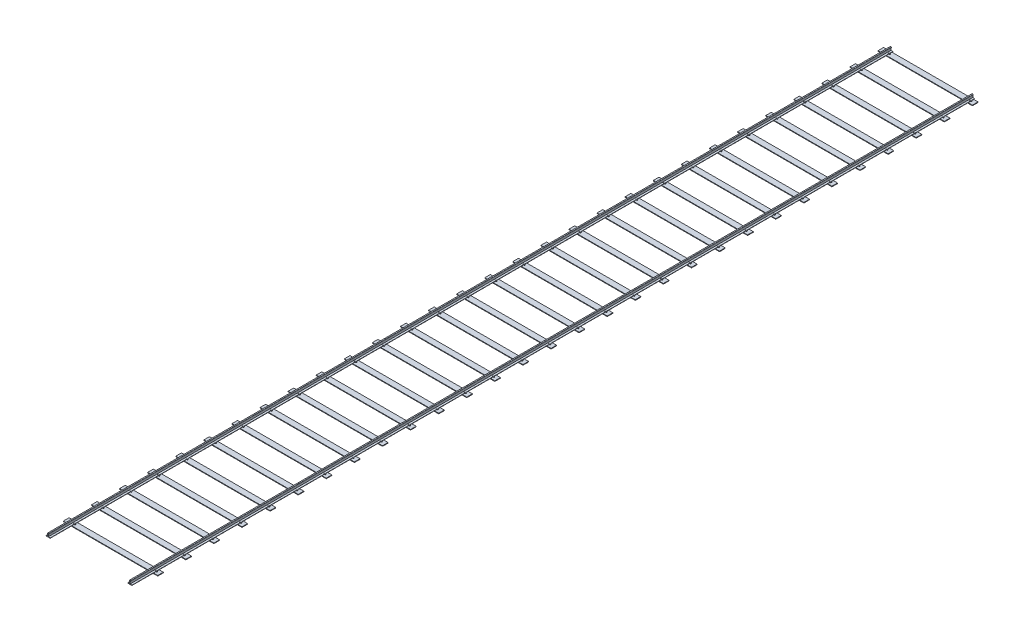
from build123d import *

# Parameters (mm, degrees)
BOSS_EXTRUDE1_START        = -43
SKETCH4_W                  = 1679
SKETCH4_H                  = 100
BOSS_EXTRUDE1_DEPTH        = 10
SKETCH6_W                  = 30
SKETCH6_H                  = 15
BOSS_EXTRUDE2_DEPTH        = 10
LPATTERN1_COUNT            = 6
LPATTERN1_PITCH            = 500
LPATTERN2_COUNT            = 5
LPATTERN2_PITCH            = 3000
LPATTERN2_START            = -43
LPATTERN2_COPY_1_SKETCH_W  = 1679
LPATTERN2_COPY_1_SKETCH_H  = 100
LPATTERN2_COPY_1_DEPTH     = 10
LPATTERN2_COPY_2_SKETCH_W  = 1679
LPATTERN2_COPY_2_SKETCH_H  = 100
LPATTERN2_COPY_2_DEPTH     = 10
LPATTERN2_COPY_3_SKETCH_W  = 1679
LPATTERN2_COPY_3_SKETCH_H  = 100
LPATTERN2_COPY_3_DEPTH     = 10
LPATTERN2_COPY_4_SKETCH_W  = 1679
LPATTERN2_COPY_4_SKETCH_H  = 100
LPATTERN2_COPY_4_DEPTH     = 10
LPATTERN2_COPY_5_SKETCH_W  = 1679
LPATTERN2_COPY_5_SKETCH_H  = 100
LPATTERN2_COPY_5_DEPTH     = 10
LPATTERN2_COPY_6_SKETCH_W  = 1679
LPATTERN2_COPY_6_SKETCH_H  = 100
LPATTERN2_COPY_6_DEPTH     = 10
LPATTERN2_COPY_7_SKETCH_W  = 1679
LPATTERN2_COPY_7_SKETCH_H  = 100
LPATTERN2_COPY_7_DEPTH     = 10
LPATTERN2_COPY_8_SKETCH_W  = 1679
LPATTERN2_COPY_8_SKETCH_H  = 100
LPATTERN2_COPY_8_DEPTH     = 10
LPATTERN2_COPY_9_SKETCH_W  = 1679
LPATTERN2_COPY_9_SKETCH_H  = 100
LPATTERN2_COPY_9_DEPTH     = 10
LPATTERN2_COPY_10_SKETCH_W = 1679
LPATTERN2_COPY_10_SKETCH_H = 100
LPATTERN2_COPY_10_DEPTH    = 10
LPATTERN2_COPY_11_SKETCH_W = 1679
LPATTERN2_COPY_11_SKETCH_H = 100
LPATTERN2_COPY_11_DEPTH    = 10
LPATTERN2_COPY_12_SKETCH_W = 1679
LPATTERN2_COPY_12_SKETCH_H = 100
LPATTERN2_COPY_12_DEPTH    = 10
LPATTERN2_COPY_13_SKETCH_W = 1679
LPATTERN2_COPY_13_SKETCH_H = 100
LPATTERN2_COPY_13_DEPTH    = 10
LPATTERN2_COPY_14_SKETCH_W = 1679
LPATTERN2_COPY_14_SKETCH_H = 100
LPATTERN2_COPY_14_DEPTH    = 10
LPATTERN2_COPY_15_SKETCH_W = 1679
LPATTERN2_COPY_15_SKETCH_H = 100
LPATTERN2_COPY_15_DEPTH    = 10
LPATTERN2_COPY_16_SKETCH_W = 1679
LPATTERN2_COPY_16_SKETCH_H = 100
LPATTERN2_COPY_16_DEPTH    = 10
LPATTERN2_COPY_17_SKETCH_W = 1679
LPATTERN2_COPY_17_SKETCH_H = 100
LPATTERN2_COPY_17_DEPTH    = 10
LPATTERN2_COPY_18_SKETCH_W = 1679
LPATTERN2_COPY_18_SKETCH_H = 100
LPATTERN2_COPY_18_DEPTH    = 10
LPATTERN2_COPY_19_SKETCH_W = 1679
LPATTERN2_COPY_19_SKETCH_H = 100
LPATTERN2_COPY_19_DEPTH    = 10
LPATTERN2_COPY_20_SKETCH_W = 1679
LPATTERN2_COPY_20_SKETCH_H = 100
LPATTERN2_COPY_20_DEPTH    = 10
LPATTERN2_COPY_21_SKETCH_W = 30
LPATTERN2_COPY_21_SKETCH_H = 15
LPATTERN2_COPY_21_DEPTH    = 10
LPATTERN2_COPY_22_SKETCH_W = 30
LPATTERN2_COPY_22_SKETCH_H = 15
LPATTERN2_COPY_22_DEPTH    = 10
LPATTERN2_COPY_23_SKETCH_W = 30
LPATTERN2_COPY_23_SKETCH_H = 15
LPATTERN2_COPY_23_DEPTH    = 10
LPATTERN2_COPY_24_SKETCH_W = 30
LPATTERN2_COPY_24_SKETCH_H = 15
LPATTERN2_COPY_24_DEPTH    = 10
LPATTERN2_COPY_25_SKETCH_W = 30
LPATTERN2_COPY_25_SKETCH_H = 15
LPATTERN2_COPY_25_DEPTH    = 10
LPATTERN2_COPY_26_SKETCH_W = 30
LPATTERN2_COPY_26_SKETCH_H = 15
LPATTERN2_COPY_26_DEPTH    = 10
LPATTERN2_COPY_27_SKETCH_W = 30
LPATTERN2_COPY_27_SKETCH_H = 15
LPATTERN2_COPY_27_DEPTH    = 10
LPATTERN2_COPY_28_SKETCH_W = 30
LPATTERN2_COPY_28_SKETCH_H = 15
LPATTERN2_COPY_28_DEPTH    = 10
LPATTERN2_COPY_29_SKETCH_W = 30
LPATTERN2_COPY_29_SKETCH_H = 15
LPATTERN2_COPY_29_DEPTH    = 10
LPATTERN2_COPY_30_SKETCH_W = 30
LPATTERN2_COPY_30_SKETCH_H = 15
LPATTERN2_COPY_30_DEPTH    = 10
LPATTERN2_COPY_31_SKETCH_W = 30
LPATTERN2_COPY_31_SKETCH_H = 15
LPATTERN2_COPY_31_DEPTH    = 10
LPATTERN2_COPY_32_SKETCH_W = 30
LPATTERN2_COPY_32_SKETCH_H = 15
LPATTERN2_COPY_32_DEPTH    = 10
LPATTERN2_COPY_33_SKETCH_W = 30
LPATTERN2_COPY_33_SKETCH_H = 15
LPATTERN2_COPY_33_DEPTH    = 10
LPATTERN2_COPY_34_SKETCH_W = 30
LPATTERN2_COPY_34_SKETCH_H = 15
LPATTERN2_COPY_34_DEPTH    = 10
LPATTERN2_COPY_35_SKETCH_W = 30
LPATTERN2_COPY_35_SKETCH_H = 15
LPATTERN2_COPY_35_DEPTH    = 10
LPATTERN2_COPY_36_SKETCH_W = 30
LPATTERN2_COPY_36_SKETCH_H = 15
LPATTERN2_COPY_36_DEPTH    = 10
LPATTERN2_COPY_37_SKETCH_W = 30
LPATTERN2_COPY_37_SKETCH_H = 15
LPATTERN2_COPY_37_DEPTH    = 10
LPATTERN2_COPY_38_SKETCH_W = 30
LPATTERN2_COPY_38_SKETCH_H = 15
LPATTERN2_COPY_38_DEPTH    = 10
LPATTERN2_COPY_39_SKETCH_W = 30
LPATTERN2_COPY_39_SKETCH_H = 15
LPATTERN2_COPY_39_DEPTH    = 10
LPATTERN2_COPY_40_SKETCH_W = 30
LPATTERN2_COPY_40_SKETCH_H = 15
LPATTERN2_COPY_40_DEPTH    = 10


with BuildPart() as part:
    # Sweep2: sweep along a path in Sketch3
    with BuildLine(Plane(origin=(0, 0, 0), x_dir=(1, 0, 0), z_dir=(0, 1, 0))) as sweep2_path:
        Line((0, 0), (0, -3000))
    # Sketch2 → Sweep2 (sweep)
    with BuildSketch(Plane.XY):
        with BuildLine():
            Line((-717.5, 0), (-717.5, 14))
            add(Edge.make_bspline(
                [(-717.5, 14), (-717.5, 17), (-727.5, 17), (-737.5, 17), (-737.5, 14)],
                knots=[3.141592654, 3.141592654, 3.141592654, 4.71238898, 4.71238898, 6.283185307, 6.283185307, 6.283185307], degree=2, weights=[1, 0.707106781, 1, 0.707106781, 1]))
            Line((-737.5, 14), (-737.5, 0))
            Line((-737.5, 0), (-734.5, -3))
            Line((-734.5, -3), (-734.5, -33))
            Line((-734.5, -33), (-764.5, -38))
            Line((-764.5, -38), (-764.5, -43))
            Line((-764.5, -43), (-690.5, -43))
            Line((-690.5, -43), (-690.5, -38))
            Line((-690.5, -38), (-720.5, -33))
            Line((-720.5, -33), (-720.5, -3))
            Line((-720.5, -3), (-717.5, 0))
        make_face()
        with BuildLine():
            Line((764.5, -43), (764.5, -38))
            Line((764.5, -38), (734.5, -33))
            Line((734.5, -33), (734.5, -3))
            Line((734.5, -3), (737.5, 0))
            Line((737.5, 0), (737.5, 14))
            add(Edge.make_bspline(
                [(737.5, 14), (737.5, 17), (727.5, 17), (717.5, 17), (717.5, 14)],
                knots=[0, 0, 0, 1.570796327, 1.570796327, 3.141592654, 3.141592654, 3.141592654], degree=2, weights=[1, 0.707106781, 1, 0.707106781, 1]))
            Line((717.5, 14), (717.5, 0))
            Line((717.5, 0), (720.5, -3))
            Line((720.5, -3), (720.5, -33))
            Line((720.5, -33), (690.5, -38))
            Line((690.5, -38), (690.5, -43))
            Line((690.5, -43), (764.5, -43))
        make_face()
    sweep2 = sweep(path=sweep2_path.line)

    # Sketch4 → Boss-Extrude1 (add)
    with BuildSketch(Plane(origin=(0, 0, 0), x_dir=(1, 0, 0), z_dir=(0, 1, 0)).offset(BOSS_EXTRUDE1_START)):
        with Locations((0, -65)):
            Rectangle(SKETCH4_W, SKETCH4_H)
    boss_extrude1 = extrude(amount=-BOSS_EXTRUDE1_DEPTH)

    # Sketch6 → Boss-Extrude2 (add)
    with BuildSketch(Plane(origin=(0, -43, 0), x_dir=(1, 0, 0), z_dir=(0, 1, 0))):
        with Locations((764.5, -65)):
            Rectangle(SKETCH6_W, SKETCH6_H)
        with Locations((690.5, -65)):
            Rectangle(SKETCH6_W, SKETCH6_H)
        with Locations((-690.5, -65)):
            Rectangle(SKETCH6_W, SKETCH6_H)
        with Locations((-764.5, -65)):
            Rectangle(SKETCH6_W, SKETCH6_H)
    boss_extrude2 = extrude(amount=BOSS_EXTRUDE2_DEPTH)

    # LPattern1: Boss-Extrude1, Boss-Extrude2 ×6
    with Locations(*[(0, 0, i * LPATTERN1_PITCH) for i in range(1, LPATTERN1_COUNT)]):
        add(boss_extrude1)
        add(boss_extrude2)

    # LPattern2: Sweep2, Boss-Extrude1, Boss-Extrude2 ×5
    with Locations(*[(0, 0, -i * LPATTERN2_PITCH) for i in range(1, LPATTERN2_COUNT)]):
        add(sweep2)
        add(boss_extrude1)
        add(boss_extrude2)

    # LPattern2 copy 1 sketch → LPattern2 copy 1 (add)
    with BuildSketch(Plane(origin=(0, 0, -2500), x_dir=(1, 0, 0), z_dir=(0, 1, 0)).offset(LPATTERN2_START)):
        with Locations((0, -65)):
            Rectangle(LPATTERN2_COPY_1_SKETCH_W, LPATTERN2_COPY_1_SKETCH_H)
    extrude(amount=-LPATTERN2_COPY_1_DEPTH)

    # LPattern2 copy 2 sketch → LPattern2 copy 2 (add)
    with BuildSketch(Plane(origin=(0, 0, -5500), x_dir=(1, 0, 0), z_dir=(0, 1, 0)).offset(LPATTERN2_START)):
        with Locations((0, -65)):
            Rectangle(LPATTERN2_COPY_2_SKETCH_W, LPATTERN2_COPY_2_SKETCH_H)
    extrude(amount=-LPATTERN2_COPY_2_DEPTH)

    # LPattern2 copy 3 sketch → LPattern2 copy 3 (add)
    with BuildSketch(Plane(origin=(0, 0, -8500), x_dir=(1, 0, 0), z_dir=(0, 1, 0)).offset(LPATTERN2_START)):
        with Locations((0, -65)):
            Rectangle(LPATTERN2_COPY_3_SKETCH_W, LPATTERN2_COPY_3_SKETCH_H)
    extrude(amount=-LPATTERN2_COPY_3_DEPTH)

    # LPattern2 copy 4 sketch → LPattern2 copy 4 (add)
    with BuildSketch(Plane(origin=(0, 0, -11500), x_dir=(1, 0, 0), z_dir=(0, 1, 0)).offset(LPATTERN2_START)):
        with Locations((0, -65)):
            Rectangle(LPATTERN2_COPY_4_SKETCH_W, LPATTERN2_COPY_4_SKETCH_H)
    extrude(amount=-LPATTERN2_COPY_4_DEPTH)

    # LPattern2 copy 5 sketch → LPattern2 copy 5 (add)
    with BuildSketch(Plane(origin=(0, 0, -2000), x_dir=(1, 0, 0), z_dir=(0, 1, 0)).offset(LPATTERN2_START)):
        with Locations((0, -65)):
            Rectangle(LPATTERN2_COPY_5_SKETCH_W, LPATTERN2_COPY_5_SKETCH_H)
    extrude(amount=-LPATTERN2_COPY_5_DEPTH)

    # LPattern2 copy 6 sketch → LPattern2 copy 6 (add)
    with BuildSketch(Plane(origin=(0, 0, -5000), x_dir=(1, 0, 0), z_dir=(0, 1, 0)).offset(LPATTERN2_START)):
        with Locations((0, -65)):
            Rectangle(LPATTERN2_COPY_6_SKETCH_W, LPATTERN2_COPY_6_SKETCH_H)
    extrude(amount=-LPATTERN2_COPY_6_DEPTH)

    # LPattern2 copy 7 sketch → LPattern2 copy 7 (add)
    with BuildSketch(Plane(origin=(0, 0, -8000), x_dir=(1, 0, 0), z_dir=(0, 1, 0)).offset(LPATTERN2_START)):
        with Locations((0, -65)):
            Rectangle(LPATTERN2_COPY_7_SKETCH_W, LPATTERN2_COPY_7_SKETCH_H)
    extrude(amount=-LPATTERN2_COPY_7_DEPTH)

    # LPattern2 copy 8 sketch → LPattern2 copy 8 (add)
    with BuildSketch(Plane(origin=(0, 0, -11000), x_dir=(1, 0, 0), z_dir=(0, 1, 0)).offset(LPATTERN2_START)):
        with Locations((0, -65)):
            Rectangle(LPATTERN2_COPY_8_SKETCH_W, LPATTERN2_COPY_8_SKETCH_H)
    extrude(amount=-LPATTERN2_COPY_8_DEPTH)

    # LPattern2 copy 9 sketch → LPattern2 copy 9 (add)
    with BuildSketch(Plane(origin=(0, 0, -1500), x_dir=(1, 0, 0), z_dir=(0, 1, 0)).offset(LPATTERN2_START)):
        with Locations((0, -65)):
            Rectangle(LPATTERN2_COPY_9_SKETCH_W, LPATTERN2_COPY_9_SKETCH_H)
    extrude(amount=-LPATTERN2_COPY_9_DEPTH)

    # LPattern2 copy 10 sketch → LPattern2 copy 10 (add)
    with BuildSketch(Plane(origin=(0, 0, -4500), x_dir=(1, 0, 0), z_dir=(0, 1, 0)).offset(LPATTERN2_START)):
        with Locations((0, -65)):
            Rectangle(LPATTERN2_COPY_10_SKETCH_W, LPATTERN2_COPY_10_SKETCH_H)
    extrude(amount=-LPATTERN2_COPY_10_DEPTH)

    # LPattern2 copy 11 sketch → LPattern2 copy 11 (add)
    with BuildSketch(Plane(origin=(0, 0, -7500), x_dir=(1, 0, 0), z_dir=(0, 1, 0)).offset(LPATTERN2_START)):
        with Locations((0, -65)):
            Rectangle(LPATTERN2_COPY_11_SKETCH_W, LPATTERN2_COPY_11_SKETCH_H)
    extrude(amount=-LPATTERN2_COPY_11_DEPTH)

    # LPattern2 copy 12 sketch → LPattern2 copy 12 (add)
    with BuildSketch(Plane(origin=(0, 0, -10500), x_dir=(1, 0, 0), z_dir=(0, 1, 0)).offset(LPATTERN2_START)):
        with Locations((0, -65)):
            Rectangle(LPATTERN2_COPY_12_SKETCH_W, LPATTERN2_COPY_12_SKETCH_H)
    extrude(amount=-LPATTERN2_COPY_12_DEPTH)

    # LPattern2 copy 13 sketch → LPattern2 copy 13 (add)
    with BuildSketch(Plane(origin=(0, 0, -1000), x_dir=(1, 0, 0), z_dir=(0, 1, 0)).offset(LPATTERN2_START)):
        with Locations((0, -65)):
            Rectangle(LPATTERN2_COPY_13_SKETCH_W, LPATTERN2_COPY_13_SKETCH_H)
    extrude(amount=-LPATTERN2_COPY_13_DEPTH)

    # LPattern2 copy 14 sketch → LPattern2 copy 14 (add)
    with BuildSketch(Plane(origin=(0, 0, -4000), x_dir=(1, 0, 0), z_dir=(0, 1, 0)).offset(LPATTERN2_START)):
        with Locations((0, -65)):
            Rectangle(LPATTERN2_COPY_14_SKETCH_W, LPATTERN2_COPY_14_SKETCH_H)
    extrude(amount=-LPATTERN2_COPY_14_DEPTH)

    # LPattern2 copy 15 sketch → LPattern2 copy 15 (add)
    with BuildSketch(Plane(origin=(0, 0, -7000), x_dir=(1, 0, 0), z_dir=(0, 1, 0)).offset(LPATTERN2_START)):
        with Locations((0, -65)):
            Rectangle(LPATTERN2_COPY_15_SKETCH_W, LPATTERN2_COPY_15_SKETCH_H)
    extrude(amount=-LPATTERN2_COPY_15_DEPTH)

    # LPattern2 copy 16 sketch → LPattern2 copy 16 (add)
    with BuildSketch(Plane(origin=(0, 0, -10000), x_dir=(1, 0, 0), z_dir=(0, 1, 0)).offset(LPATTERN2_START)):
        with Locations((0, -65)):
            Rectangle(LPATTERN2_COPY_16_SKETCH_W, LPATTERN2_COPY_16_SKETCH_H)
    extrude(amount=-LPATTERN2_COPY_16_DEPTH)

    # LPattern2 copy 17 sketch → LPattern2 copy 17 (add)
    with BuildSketch(Plane(origin=(0, 0, -500), x_dir=(1, 0, 0), z_dir=(0, 1, 0)).offset(LPATTERN2_START)):
        with Locations((0, -65)):
            Rectangle(LPATTERN2_COPY_17_SKETCH_W, LPATTERN2_COPY_17_SKETCH_H)
    extrude(amount=-LPATTERN2_COPY_17_DEPTH)

    # LPattern2 copy 18 sketch → LPattern2 copy 18 (add)
    with BuildSketch(Plane(origin=(0, 0, -3500), x_dir=(1, 0, 0), z_dir=(0, 1, 0)).offset(LPATTERN2_START)):
        with Locations((0, -65)):
            Rectangle(LPATTERN2_COPY_18_SKETCH_W, LPATTERN2_COPY_18_SKETCH_H)
    extrude(amount=-LPATTERN2_COPY_18_DEPTH)

    # LPattern2 copy 19 sketch → LPattern2 copy 19 (add)
    with BuildSketch(Plane(origin=(0, 0, -6500), x_dir=(1, 0, 0), z_dir=(0, 1, 0)).offset(LPATTERN2_START)):
        with Locations((0, -65)):
            Rectangle(LPATTERN2_COPY_19_SKETCH_W, LPATTERN2_COPY_19_SKETCH_H)
    extrude(amount=-LPATTERN2_COPY_19_DEPTH)

    # LPattern2 copy 20 sketch → LPattern2 copy 20 (add)
    with BuildSketch(Plane(origin=(0, 0, -9500), x_dir=(1, 0, 0), z_dir=(0, 1, 0)).offset(LPATTERN2_START)):
        with Locations((0, -65)):
            Rectangle(LPATTERN2_COPY_20_SKETCH_W, LPATTERN2_COPY_20_SKETCH_H)
    extrude(amount=-LPATTERN2_COPY_20_DEPTH)

    # LPattern2 copy 21 sketch → LPattern2 copy 21 (add)
    with BuildSketch(Plane(origin=(0, -43, -2500), x_dir=(1, 0, 0), z_dir=(0, 1, 0))):
        with Locations((764.5, -65)):
            Rectangle(LPATTERN2_COPY_21_SKETCH_W, LPATTERN2_COPY_21_SKETCH_H)
        with Locations((690.5, -65)):
            Rectangle(LPATTERN2_COPY_21_SKETCH_W, LPATTERN2_COPY_21_SKETCH_H)
        with Locations((-690.5, -65)):
            Rectangle(LPATTERN2_COPY_21_SKETCH_W, LPATTERN2_COPY_21_SKETCH_H)
        with Locations((-764.5, -65)):
            Rectangle(LPATTERN2_COPY_21_SKETCH_W, LPATTERN2_COPY_21_SKETCH_H)
    extrude(amount=LPATTERN2_COPY_21_DEPTH)

    # LPattern2 copy 22 sketch → LPattern2 copy 22 (add)
    with BuildSketch(Plane(origin=(0, -43, -5500), x_dir=(1, 0, 0), z_dir=(0, 1, 0))):
        with Locations((764.5, -65)):
            Rectangle(LPATTERN2_COPY_22_SKETCH_W, LPATTERN2_COPY_22_SKETCH_H)
        with Locations((690.5, -65)):
            Rectangle(LPATTERN2_COPY_22_SKETCH_W, LPATTERN2_COPY_22_SKETCH_H)
        with Locations((-690.5, -65)):
            Rectangle(LPATTERN2_COPY_22_SKETCH_W, LPATTERN2_COPY_22_SKETCH_H)
        with Locations((-764.5, -65)):
            Rectangle(LPATTERN2_COPY_22_SKETCH_W, LPATTERN2_COPY_22_SKETCH_H)
    extrude(amount=LPATTERN2_COPY_22_DEPTH)

    # LPattern2 copy 23 sketch → LPattern2 copy 23 (add)
    with BuildSketch(Plane(origin=(0, -43, -8500), x_dir=(1, 0, 0), z_dir=(0, 1, 0))):
        with Locations((764.5, -65)):
            Rectangle(LPATTERN2_COPY_23_SKETCH_W, LPATTERN2_COPY_23_SKETCH_H)
        with Locations((690.5, -65)):
            Rectangle(LPATTERN2_COPY_23_SKETCH_W, LPATTERN2_COPY_23_SKETCH_H)
        with Locations((-690.5, -65)):
            Rectangle(LPATTERN2_COPY_23_SKETCH_W, LPATTERN2_COPY_23_SKETCH_H)
        with Locations((-764.5, -65)):
            Rectangle(LPATTERN2_COPY_23_SKETCH_W, LPATTERN2_COPY_23_SKETCH_H)
    extrude(amount=LPATTERN2_COPY_23_DEPTH)

    # LPattern2 copy 24 sketch → LPattern2 copy 24 (add)
    with BuildSketch(Plane(origin=(0, -43, -11500), x_dir=(1, 0, 0), z_dir=(0, 1, 0))):
        with Locations((764.5, -65)):
            Rectangle(LPATTERN2_COPY_24_SKETCH_W, LPATTERN2_COPY_24_SKETCH_H)
        with Locations((690.5, -65)):
            Rectangle(LPATTERN2_COPY_24_SKETCH_W, LPATTERN2_COPY_24_SKETCH_H)
        with Locations((-690.5, -65)):
            Rectangle(LPATTERN2_COPY_24_SKETCH_W, LPATTERN2_COPY_24_SKETCH_H)
        with Locations((-764.5, -65)):
            Rectangle(LPATTERN2_COPY_24_SKETCH_W, LPATTERN2_COPY_24_SKETCH_H)
    extrude(amount=LPATTERN2_COPY_24_DEPTH)

    # LPattern2 copy 25 sketch → LPattern2 copy 25 (add)
    with BuildSketch(Plane(origin=(0, -43, -2000), x_dir=(1, 0, 0), z_dir=(0, 1, 0))):
        with Locations((764.5, -65)):
            Rectangle(LPATTERN2_COPY_25_SKETCH_W, LPATTERN2_COPY_25_SKETCH_H)
        with Locations((690.5, -65)):
            Rectangle(LPATTERN2_COPY_25_SKETCH_W, LPATTERN2_COPY_25_SKETCH_H)
        with Locations((-690.5, -65)):
            Rectangle(LPATTERN2_COPY_25_SKETCH_W, LPATTERN2_COPY_25_SKETCH_H)
        with Locations((-764.5, -65)):
            Rectangle(LPATTERN2_COPY_25_SKETCH_W, LPATTERN2_COPY_25_SKETCH_H)
    extrude(amount=LPATTERN2_COPY_25_DEPTH)

    # LPattern2 copy 26 sketch → LPattern2 copy 26 (add)
    with BuildSketch(Plane(origin=(0, -43, -5000), x_dir=(1, 0, 0), z_dir=(0, 1, 0))):
        with Locations((764.5, -65)):
            Rectangle(LPATTERN2_COPY_26_SKETCH_W, LPATTERN2_COPY_26_SKETCH_H)
        with Locations((690.5, -65)):
            Rectangle(LPATTERN2_COPY_26_SKETCH_W, LPATTERN2_COPY_26_SKETCH_H)
        with Locations((-690.5, -65)):
            Rectangle(LPATTERN2_COPY_26_SKETCH_W, LPATTERN2_COPY_26_SKETCH_H)
        with Locations((-764.5, -65)):
            Rectangle(LPATTERN2_COPY_26_SKETCH_W, LPATTERN2_COPY_26_SKETCH_H)
    extrude(amount=LPATTERN2_COPY_26_DEPTH)

    # LPattern2 copy 27 sketch → LPattern2 copy 27 (add)
    with BuildSketch(Plane(origin=(0, -43, -8000), x_dir=(1, 0, 0), z_dir=(0, 1, 0))):
        with Locations((764.5, -65)):
            Rectangle(LPATTERN2_COPY_27_SKETCH_W, LPATTERN2_COPY_27_SKETCH_H)
        with Locations((690.5, -65)):
            Rectangle(LPATTERN2_COPY_27_SKETCH_W, LPATTERN2_COPY_27_SKETCH_H)
        with Locations((-690.5, -65)):
            Rectangle(LPATTERN2_COPY_27_SKETCH_W, LPATTERN2_COPY_27_SKETCH_H)
        with Locations((-764.5, -65)):
            Rectangle(LPATTERN2_COPY_27_SKETCH_W, LPATTERN2_COPY_27_SKETCH_H)
    extrude(amount=LPATTERN2_COPY_27_DEPTH)

    # LPattern2 copy 28 sketch → LPattern2 copy 28 (add)
    with BuildSketch(Plane(origin=(0, -43, -11000), x_dir=(1, 0, 0), z_dir=(0, 1, 0))):
        with Locations((764.5, -65)):
            Rectangle(LPATTERN2_COPY_28_SKETCH_W, LPATTERN2_COPY_28_SKETCH_H)
        with Locations((690.5, -65)):
            Rectangle(LPATTERN2_COPY_28_SKETCH_W, LPATTERN2_COPY_28_SKETCH_H)
        with Locations((-690.5, -65)):
            Rectangle(LPATTERN2_COPY_28_SKETCH_W, LPATTERN2_COPY_28_SKETCH_H)
        with Locations((-764.5, -65)):
            Rectangle(LPATTERN2_COPY_28_SKETCH_W, LPATTERN2_COPY_28_SKETCH_H)
    extrude(amount=LPATTERN2_COPY_28_DEPTH)

    # LPattern2 copy 29 sketch → LPattern2 copy 29 (add)
    with BuildSketch(Plane(origin=(0, -43, -1500), x_dir=(1, 0, 0), z_dir=(0, 1, 0))):
        with Locations((764.5, -65)):
            Rectangle(LPATTERN2_COPY_29_SKETCH_W, LPATTERN2_COPY_29_SKETCH_H)
        with Locations((690.5, -65)):
            Rectangle(LPATTERN2_COPY_29_SKETCH_W, LPATTERN2_COPY_29_SKETCH_H)
        with Locations((-690.5, -65)):
            Rectangle(LPATTERN2_COPY_29_SKETCH_W, LPATTERN2_COPY_29_SKETCH_H)
        with Locations((-764.5, -65)):
            Rectangle(LPATTERN2_COPY_29_SKETCH_W, LPATTERN2_COPY_29_SKETCH_H)
    extrude(amount=LPATTERN2_COPY_29_DEPTH)

    # LPattern2 copy 30 sketch → LPattern2 copy 30 (add)
    with BuildSketch(Plane(origin=(0, -43, -4500), x_dir=(1, 0, 0), z_dir=(0, 1, 0))):
        with Locations((764.5, -65)):
            Rectangle(LPATTERN2_COPY_30_SKETCH_W, LPATTERN2_COPY_30_SKETCH_H)
        with Locations((690.5, -65)):
            Rectangle(LPATTERN2_COPY_30_SKETCH_W, LPATTERN2_COPY_30_SKETCH_H)
        with Locations((-690.5, -65)):
            Rectangle(LPATTERN2_COPY_30_SKETCH_W, LPATTERN2_COPY_30_SKETCH_H)
        with Locations((-764.5, -65)):
            Rectangle(LPATTERN2_COPY_30_SKETCH_W, LPATTERN2_COPY_30_SKETCH_H)
    extrude(amount=LPATTERN2_COPY_30_DEPTH)

    # LPattern2 copy 31 sketch → LPattern2 copy 31 (add)
    with BuildSketch(Plane(origin=(0, -43, -7500), x_dir=(1, 0, 0), z_dir=(0, 1, 0))):
        with Locations((764.5, -65)):
            Rectangle(LPATTERN2_COPY_31_SKETCH_W, LPATTERN2_COPY_31_SKETCH_H)
        with Locations((690.5, -65)):
            Rectangle(LPATTERN2_COPY_31_SKETCH_W, LPATTERN2_COPY_31_SKETCH_H)
        with Locations((-690.5, -65)):
            Rectangle(LPATTERN2_COPY_31_SKETCH_W, LPATTERN2_COPY_31_SKETCH_H)
        with Locations((-764.5, -65)):
            Rectangle(LPATTERN2_COPY_31_SKETCH_W, LPATTERN2_COPY_31_SKETCH_H)
    extrude(amount=LPATTERN2_COPY_31_DEPTH)

    # LPattern2 copy 32 sketch → LPattern2 copy 32 (add)
    with BuildSketch(Plane(origin=(0, -43, -10500), x_dir=(1, 0, 0), z_dir=(0, 1, 0))):
        with Locations((764.5, -65)):
            Rectangle(LPATTERN2_COPY_32_SKETCH_W, LPATTERN2_COPY_32_SKETCH_H)
        with Locations((690.5, -65)):
            Rectangle(LPATTERN2_COPY_32_SKETCH_W, LPATTERN2_COPY_32_SKETCH_H)
        with Locations((-690.5, -65)):
            Rectangle(LPATTERN2_COPY_32_SKETCH_W, LPATTERN2_COPY_32_SKETCH_H)
        with Locations((-764.5, -65)):
            Rectangle(LPATTERN2_COPY_32_SKETCH_W, LPATTERN2_COPY_32_SKETCH_H)
    extrude(amount=LPATTERN2_COPY_32_DEPTH)

    # LPattern2 copy 33 sketch → LPattern2 copy 33 (add)
    with BuildSketch(Plane(origin=(0, -43, -1000), x_dir=(1, 0, 0), z_dir=(0, 1, 0))):
        with Locations((764.5, -65)):
            Rectangle(LPATTERN2_COPY_33_SKETCH_W, LPATTERN2_COPY_33_SKETCH_H)
        with Locations((690.5, -65)):
            Rectangle(LPATTERN2_COPY_33_SKETCH_W, LPATTERN2_COPY_33_SKETCH_H)
        with Locations((-690.5, -65)):
            Rectangle(LPATTERN2_COPY_33_SKETCH_W, LPATTERN2_COPY_33_SKETCH_H)
        with Locations((-764.5, -65)):
            Rectangle(LPATTERN2_COPY_33_SKETCH_W, LPATTERN2_COPY_33_SKETCH_H)
    extrude(amount=LPATTERN2_COPY_33_DEPTH)

    # LPattern2 copy 34 sketch → LPattern2 copy 34 (add)
    with BuildSketch(Plane(origin=(0, -43, -4000), x_dir=(1, 0, 0), z_dir=(0, 1, 0))):
        with Locations((764.5, -65)):
            Rectangle(LPATTERN2_COPY_34_SKETCH_W, LPATTERN2_COPY_34_SKETCH_H)
        with Locations((690.5, -65)):
            Rectangle(LPATTERN2_COPY_34_SKETCH_W, LPATTERN2_COPY_34_SKETCH_H)
        with Locations((-690.5, -65)):
            Rectangle(LPATTERN2_COPY_34_SKETCH_W, LPATTERN2_COPY_34_SKETCH_H)
        with Locations((-764.5, -65)):
            Rectangle(LPATTERN2_COPY_34_SKETCH_W, LPATTERN2_COPY_34_SKETCH_H)
    extrude(amount=LPATTERN2_COPY_34_DEPTH)

    # LPattern2 copy 35 sketch → LPattern2 copy 35 (add)
    with BuildSketch(Plane(origin=(0, -43, -7000), x_dir=(1, 0, 0), z_dir=(0, 1, 0))):
        with Locations((764.5, -65)):
            Rectangle(LPATTERN2_COPY_35_SKETCH_W, LPATTERN2_COPY_35_SKETCH_H)
        with Locations((690.5, -65)):
            Rectangle(LPATTERN2_COPY_35_SKETCH_W, LPATTERN2_COPY_35_SKETCH_H)
        with Locations((-690.5, -65)):
            Rectangle(LPATTERN2_COPY_35_SKETCH_W, LPATTERN2_COPY_35_SKETCH_H)
        with Locations((-764.5, -65)):
            Rectangle(LPATTERN2_COPY_35_SKETCH_W, LPATTERN2_COPY_35_SKETCH_H)
    extrude(amount=LPATTERN2_COPY_35_DEPTH)

    # LPattern2 copy 36 sketch → LPattern2 copy 36 (add)
    with BuildSketch(Plane(origin=(0, -43, -10000), x_dir=(1, 0, 0), z_dir=(0, 1, 0))):
        with Locations((764.5, -65)):
            Rectangle(LPATTERN2_COPY_36_SKETCH_W, LPATTERN2_COPY_36_SKETCH_H)
        with Locations((690.5, -65)):
            Rectangle(LPATTERN2_COPY_36_SKETCH_W, LPATTERN2_COPY_36_SKETCH_H)
        with Locations((-690.5, -65)):
            Rectangle(LPATTERN2_COPY_36_SKETCH_W, LPATTERN2_COPY_36_SKETCH_H)
        with Locations((-764.5, -65)):
            Rectangle(LPATTERN2_COPY_36_SKETCH_W, LPATTERN2_COPY_36_SKETCH_H)
    extrude(amount=LPATTERN2_COPY_36_DEPTH)

    # LPattern2 copy 37 sketch → LPattern2 copy 37 (add)
    with BuildSketch(Plane(origin=(0, -43, -500), x_dir=(1, 0, 0), z_dir=(0, 1, 0))):
        with Locations((764.5, -65)):
            Rectangle(LPATTERN2_COPY_37_SKETCH_W, LPATTERN2_COPY_37_SKETCH_H)
        with Locations((690.5, -65)):
            Rectangle(LPATTERN2_COPY_37_SKETCH_W, LPATTERN2_COPY_37_SKETCH_H)
        with Locations((-690.5, -65)):
            Rectangle(LPATTERN2_COPY_37_SKETCH_W, LPATTERN2_COPY_37_SKETCH_H)
        with Locations((-764.5, -65)):
            Rectangle(LPATTERN2_COPY_37_SKETCH_W, LPATTERN2_COPY_37_SKETCH_H)
    extrude(amount=LPATTERN2_COPY_37_DEPTH)

    # LPattern2 copy 38 sketch → LPattern2 copy 38 (add)
    with BuildSketch(Plane(origin=(0, -43, -3500), x_dir=(1, 0, 0), z_dir=(0, 1, 0))):
        with Locations((764.5, -65)):
            Rectangle(LPATTERN2_COPY_38_SKETCH_W, LPATTERN2_COPY_38_SKETCH_H)
        with Locations((690.5, -65)):
            Rectangle(LPATTERN2_COPY_38_SKETCH_W, LPATTERN2_COPY_38_SKETCH_H)
        with Locations((-690.5, -65)):
            Rectangle(LPATTERN2_COPY_38_SKETCH_W, LPATTERN2_COPY_38_SKETCH_H)
        with Locations((-764.5, -65)):
            Rectangle(LPATTERN2_COPY_38_SKETCH_W, LPATTERN2_COPY_38_SKETCH_H)
    extrude(amount=LPATTERN2_COPY_38_DEPTH)

    # LPattern2 copy 39 sketch → LPattern2 copy 39 (add)
    with BuildSketch(Plane(origin=(0, -43, -6500), x_dir=(1, 0, 0), z_dir=(0, 1, 0))):
        with Locations((764.5, -65)):
            Rectangle(LPATTERN2_COPY_39_SKETCH_W, LPATTERN2_COPY_39_SKETCH_H)
        with Locations((690.5, -65)):
            Rectangle(LPATTERN2_COPY_39_SKETCH_W, LPATTERN2_COPY_39_SKETCH_H)
        with Locations((-690.5, -65)):
            Rectangle(LPATTERN2_COPY_39_SKETCH_W, LPATTERN2_COPY_39_SKETCH_H)
        with Locations((-764.5, -65)):
            Rectangle(LPATTERN2_COPY_39_SKETCH_W, LPATTERN2_COPY_39_SKETCH_H)
    extrude(amount=LPATTERN2_COPY_39_DEPTH)

    # LPattern2 copy 40 sketch → LPattern2 copy 40 (add)
    with BuildSketch(Plane(origin=(0, -43, -9500), x_dir=(1, 0, 0), z_dir=(0, 1, 0))):
        with Locations((764.5, -65)):
            Rectangle(LPATTERN2_COPY_40_SKETCH_W, LPATTERN2_COPY_40_SKETCH_H)
        with Locations((690.5, -65)):
            Rectangle(LPATTERN2_COPY_40_SKETCH_W, LPATTERN2_COPY_40_SKETCH_H)
        with Locations((-690.5, -65)):
            Rectangle(LPATTERN2_COPY_40_SKETCH_W, LPATTERN2_COPY_40_SKETCH_H)
        with Locations((-764.5, -65)):
            Rectangle(LPATTERN2_COPY_40_SKETCH_W, LPATTERN2_COPY_40_SKETCH_H)
    extrude(amount=LPATTERN2_COPY_40_DEPTH)


solid = part.part
